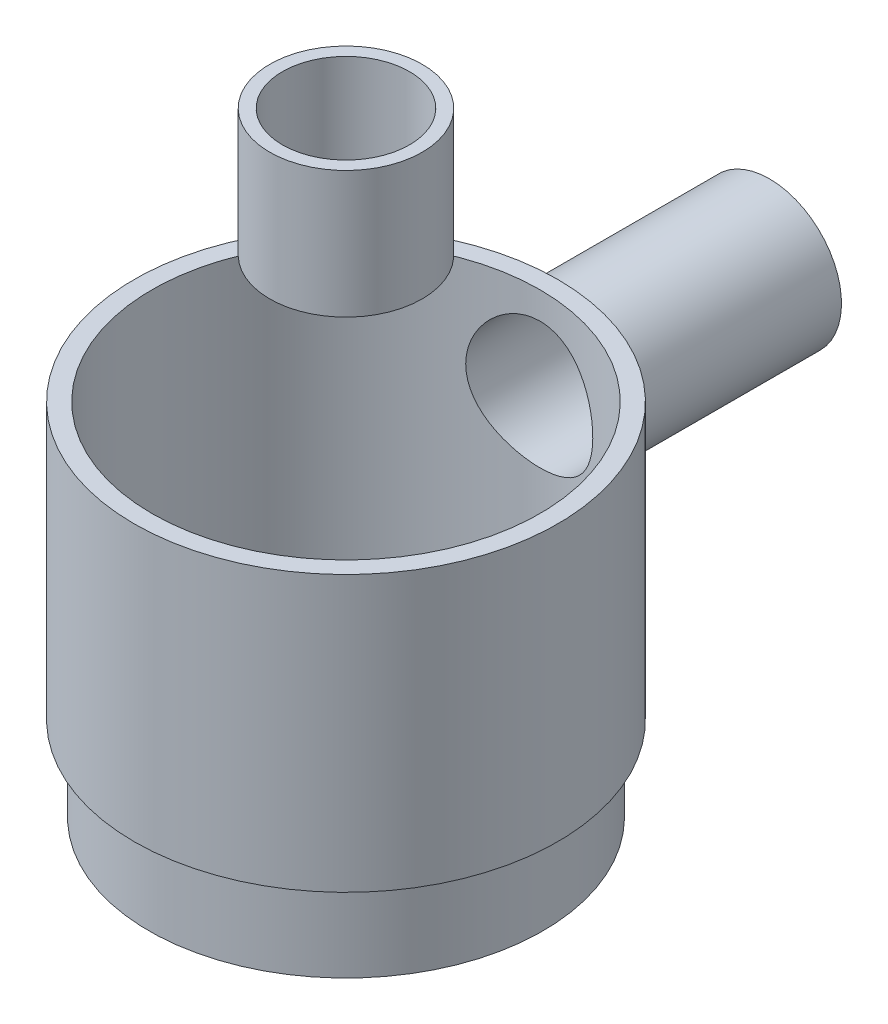
from build123d import *
from build123d.topology import SkipClean

# Parameters (mm, degrees)
SKETCH2_R                       = 25
BOSS_EXTRUDE1_DEPTH             = 32.5
SKETCH3_R                       = 23.25
BOSS_EXTRUDE2_DEPTH             = 10
SKETCH4_R                       = 22.9
CUT_EXTRUDE1_DEPTH              = 56.283360969
SKETCH5_R                       = 9
SKETCH5_R_2                     = 7.5
EXTRUDE_THIN1_DEPTH             = 15
CUT_EXTRUDE2_REACH              = 85.853
CUT_EXTRUDE2_END_RADIUS         = 22.9
SKETCH6_R                       = 7.5
EXTRUDE_THIN4_REACH             = 85.853
EXTRUDE_THIN4_END_RADIUS        = 25
SKETCH6_3_R                     = 8.5
SKETCH6_3_R_2                   = 7.5
EXTRUDE_THIN4_DIRECTION_2_DEPTH = 25


with BuildPart() as part:
    # Sketch2 → Boss-Extrude1 (new body)
    with BuildSketch(Plane(origin=(0, 0, 0), x_dir=(1, 0, 0), z_dir=(0, 1, 0))):
        with Locations(Location((0, 0, 0), (0, 0, 270))):
            Circle(SKETCH2_R)
    extrude(amount=BOSS_EXTRUDE1_DEPTH)

    # Sketch3 → Boss-Extrude2 (add)
    with BuildSketch(Plane.XZ):
        with Locations(Location((0, 0, 0), (0, 0, 270))):
            Circle(SKETCH3_R)
    extrude(amount=BOSS_EXTRUDE2_DEPTH)

    # Sketch4 → Cut-Extrude1 (cut, through all)
    with BuildSketch(Plane.XZ.offset(10)):
        with Locations(Location((0, 0, 0), (0, 0, 270))):
            Circle(SKETCH4_R)
    extrude(amount=-CUT_EXTRUDE1_DEPTH, mode=Mode.SUBTRACT)

    # Cut-Extrude2: up to this cylinder (the profile starts outside it)
    cut_extrude2_end = Plane(origin=(0, 21.786891, 0), z_dir=(0, -1, 0)) * Cylinder(CUT_EXTRUDE2_END_RADIUS, 218.506, mode=Mode.PRIVATE)
    # Sketch6 → Cut-Extrude2 (cut, up to the surface)
    with BuildSketch(Plane(origin=(0, 0, -25), x_dir=(-1, 0, 0), z_dir=(0, 0, -1)), mode=Mode.PRIVATE) as cut_extrude2_sk1:
        with Locations((0, 21.7868914)):
            Circle(SKETCH6_R)
    cut_extrude2_tool1 = extrude(cut_extrude2_sk1.sketch, amount=-CUT_EXTRUDE2_REACH, mode=Mode.PRIVATE) - cut_extrude2_end
    add(cut_extrude2_tool1.solids().sort_by_distance((0, 21.786891, -25))[0], mode=Mode.SUBTRACT)

    # Extrude-Thin4: up to this cylinder (the profile starts outside it)
    extrude_thin4_end = Plane(origin=(0, 21.786891, 0), z_dir=(0, -1, 0)) * Cylinder(EXTRUDE_THIN4_END_RADIUS, 222.706, mode=Mode.PRIVATE)
    # Sketch6<3> → Extrude-Thin4 (add, up to the surface)
    with BuildSketch(Plane(origin=(0, 0, -25), x_dir=(-1, 0, 0), z_dir=(0, 0, -1)), mode=Mode.PRIVATE) as extrude_thin4_sk1:
        with Locations((0, 21.7868914)):
            Circle(SKETCH6_3_R)
        with Locations((0, 21.7868914)):
            Circle(SKETCH6_3_R_2, mode=Mode.SUBTRACT)
    extrude_thin4_tool1 = extrude(extrude_thin4_sk1.sketch, amount=-EXTRUDE_THIN4_REACH, mode=Mode.PRIVATE) - extrude_thin4_end
    add(extrude_thin4_tool1.solids().sort_by_distance((8.259584, 21.786891, -25))[0])
    add(extrude_thin4_tool1.solids().sort_by_distance((8.259584, 21.786891, -25))[1])

    # Sketch6<3> → Extrude-Thin4 direction 2 (add)
    with SkipClean():  # the faces are left unmerged after this step: merging them gives an invalid solid
        with BuildSketch(Plane(origin=(0, 0, -25), x_dir=(-1, 0, 0), z_dir=(0, 0, -1))):
            with Locations((0, 21.7868914)):
                Circle(SKETCH6_3_R)
            with Locations((0, 21.7868914)):
                Circle(SKETCH6_3_R_2, mode=Mode.SUBTRACT)
        extrude(amount=EXTRUDE_THIN4_DIRECTION_2_DEPTH)


with BuildPart() as body_2:
    # Sketch5 → Extrude-Thin1 (new body)
    with BuildSketch(Plane(origin=(0, 47.5, 0), x_dir=(1, 0, 0), z_dir=(0, 1, 0))):
        Circle(SKETCH5_R)
        Circle(SKETCH5_R_2, mode=Mode.SUBTRACT)
    extrude(amount=EXTRUDE_THIN1_DEPTH)


solid = Compound([part.part, body_2.part])
